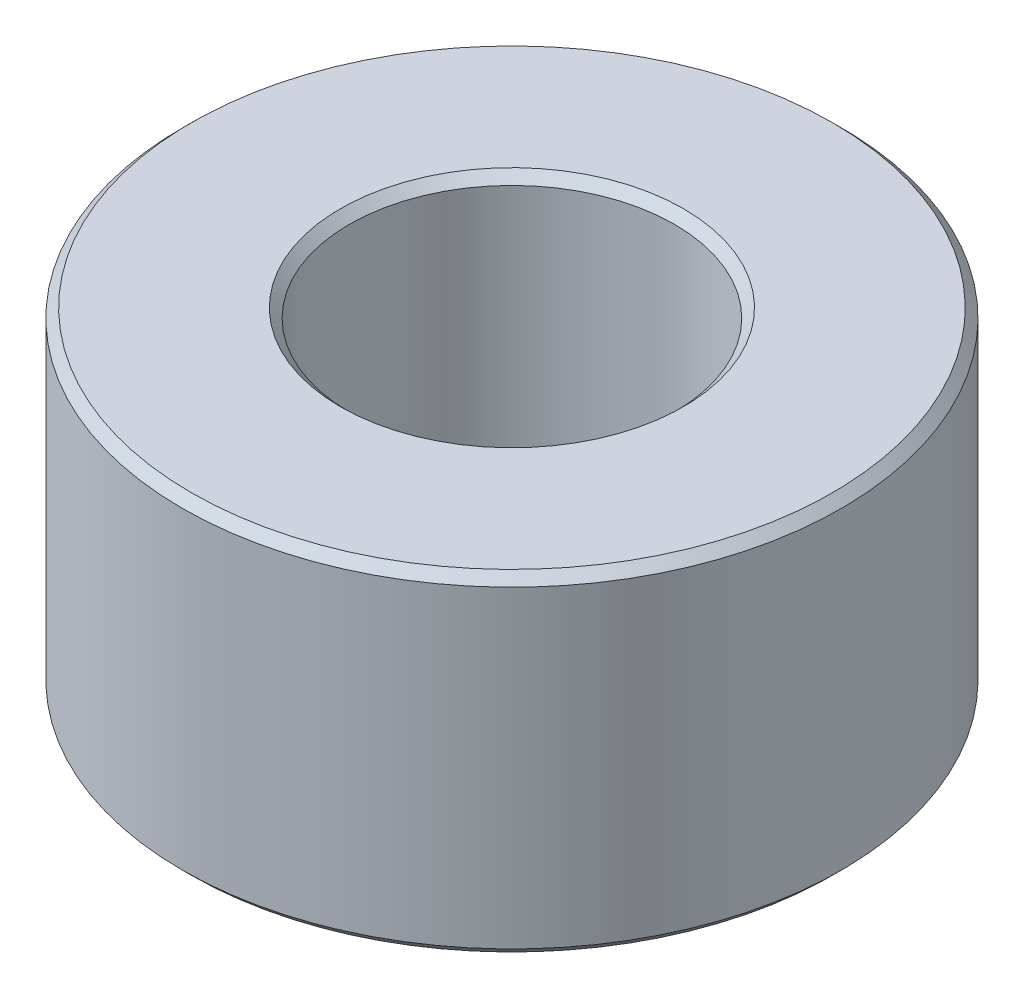
from build123d import *

# Parameters (mm, degrees)
SKETCH1_R           = 25
BOSS_EXTRUDE1_DEPTH = 25.133148237
SKETCH2_R           = 12.329132894
CUT_EXTRUDE1_DEPTH  = 44.378279591
CHAMFER1_SIZE       = 0.6842555


with BuildPart() as part:
    # Sketch1 → Boss-Extrude1 (new body)
    with BuildSketch(Plane(origin=(0, 0, 0), x_dir=(1, 0, 0), z_dir=(0, 1, 0))):
        Circle(SKETCH1_R)
    extrude(amount=BOSS_EXTRUDE1_DEPTH)

    # Sketch2 → Cut-Extrude1 (cut, through all)
    with BuildSketch(Plane(origin=(0, 0, 0), x_dir=(1, 0, 0), z_dir=(0, 1, 0))):
        Circle(SKETCH2_R)
    extrude(amount=CUT_EXTRUDE1_DEPTH, mode=Mode.SUBTRACT)

    # Chamfer1
    chamfer1_edges = [part.edges().sort_by_distance(p)[0] for p in [
        (-12.329132894, 25.133148237, 0),
        (-12.329132894, 0, 0),
        (-25, 0, 0),
        (-25, 25.133148237, 0),
    ]]
    chamfer(chamfer1_edges, length=CHAMFER1_SIZE)


solid = part.part
